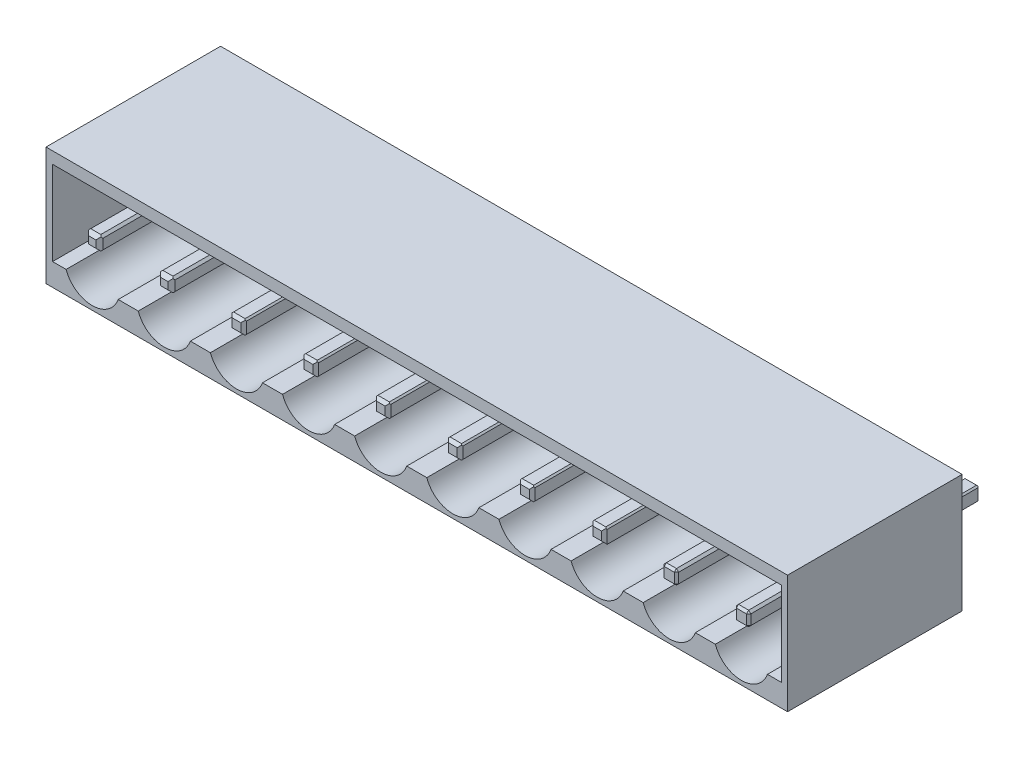
from build123d import *

# Parameters (mm, degrees)
SKETCH_1_W          = 51.4
SKETCH_1_H          = 8.2
EXTRUDE_1_DEPTH     = 12.1
SKETCH_4_R          = 1.25
CUT_EXTRUDE_3_DEPTH = 8
CUT_EXTRUDE_4_DEPTH = 7.8
SKETCH_7_W          = 1
SKETCH_7_H          = 1
EXTRUDE_2_DEPTH     = 8
CHAMFER_1_SIZE      = 0.15
CHAMFER_2_SIZE      = 0.25
SKETCH_8_W          = 1
SKETCH_8_H          = 1
EXTRUDE_3_DEPTH     = 4
CHAMFER_6_SIZE      = 0.1
CHAMFER_7_SIZE      = 0.2
CHAMFER_10_SIZE     = 0.1
CHAMFER_11_SIZE     = 0.2
CHAMFER_12_SIZE     = 0.1
CHAMFER_13_SIZE     = 0.2
CHAMFER_14_SIZE     = 0.1
CHAMFER_15_SIZE     = 0.2


with BuildPart() as part:
    # Эскиз1 → Бобышка-Вытянуть1 (new body)
    with BuildSketch(Plane.XY):
        Rectangle(SKETCH_1_W, SKETCH_1_H)
    extrude(amount=EXTRUDE_1_DEPTH)

    # Эскиз4 → Вырез-Вытянуть3 (cut)
    with BuildSketch(Plane.XY.offset(12.1)):
        with Locations((-22.5, 0)):
            Circle(SKETCH_4_R)
        with Locations((-17.5, 0)):
            Circle(SKETCH_4_R)
        with Locations((-12.5, 0)):
            Circle(SKETCH_4_R)
        with Locations((-7.5, 0)):
            Circle(SKETCH_4_R)
        with Locations((-2.5, 0)):
            Circle(SKETCH_4_R)
        with Locations((2.5, 0)):
            Circle(SKETCH_4_R)
        with Locations((7.5, 0)):
            Circle(SKETCH_4_R)
        with Locations((12.5, 0)):
            Circle(SKETCH_4_R)
        with Locations((17.5, 0)):
            Circle(SKETCH_4_R)
        with Locations((22.5, 0)):
            Circle(SKETCH_4_R)
    extrude(amount=-CUT_EXTRUDE_3_DEPTH, mode=Mode.SUBTRACT)

    # Эскиз5 → Вырез-Вытянуть4 (cut)
    with BuildSketch(Plane.XY.offset(12.1)):
        with BuildLine():
            Line((-25.245621634, 0), (-25.245621634, 3.292901982))
            Line((-25.245621634, 3.292901982), (-14.721490456, 3.292901982))
            Line((-14.721490456, 3.292901982), (-9.721490456, 3.292901982))
            Line((-9.721490456, 3.292901982), (-4.721490456, 3.292901982))
            Line((-4.721490456, 3.292901982), (5.278509544, 3.292901982))
            Line((5.278509544, 3.292901982), (15.278509544, 3.292901982))
            Line((15.278509544, 3.292901982), (25.278509544, 3.292901982))
            Line((25.278509544, 3.292901982), (25.278509544, -2.548957219))
            Line((25.278509544, -2.548957219), (24.30582632, -2.548957219))
            ThreePointArc((24.30582632, -2.548957219), (22.5, -3.818893996), (20.69417368, -2.548957219))
            Line((20.69417368, -2.548957219), (19.30582632, -2.548957219))
            ThreePointArc((19.30582632, -2.548957219), (17.5, -3.818893996), (15.69417368, -2.548957219))
            Line((15.69417368, -2.548957219), (14.30582632, -2.548957219))
            ThreePointArc((14.30582632, -2.548957219), (12.5, -3.818893996), (10.69417368, -2.548957219))
            Line((10.69417368, -2.548957219), (9.30582632, -2.548957219))
            ThreePointArc((9.30582632, -2.548957219), (7.5, -3.818893996), (5.69417368, -2.548957219))
            Line((5.69417368, -2.548957219), (4.30582632, -2.548957219))
            ThreePointArc((4.30582632, -2.548957219), (2.5, -3.818893996), (0.69417368, -2.548957219))
            Line((0.69417368, -2.548957219), (-0.69417368, -2.548957219))
            ThreePointArc((-0.69417368, -2.548957219), (-2.5, -3.818893996), (-4.30582632, -2.548957219))
            Line((-4.30582632, -2.548957219), (-5.69417368, -2.548957219))
            ThreePointArc((-5.69417368, -2.548957219), (-7.5, -3.818893996), (-9.30582632, -2.548957219))
            Line((-9.30582632, -2.548957219), (-10.69417368, -2.548957219))
            ThreePointArc((-10.69417368, -2.548957219), (-12.5, -3.818893996), (-14.30582632, -2.548957219))
            Line((-14.30582632, -2.548957219), (-15.69417368, -2.548957219))
            ThreePointArc((-15.69417368, -2.548957219), (-17.5, -3.818893996), (-19.30582632, -2.548957219))
            Line((-19.30582632, -2.548957219), (-20.69417368, -2.548957219))
            ThreePointArc((-20.69417368, -2.548957219), (-22.5, -3.818893996), (-24.30582632, -2.548957219))
            Line((-24.30582632, -2.548957219), (-25.245621634, -2.548957219))
            Line((-25.245621634, -2.548957219), (-25.245621634, 0))
        make_face()
    extrude(amount=-CUT_EXTRUDE_4_DEPTH, mode=Mode.SUBTRACT)

    # Эскиз7 → Бобышка-Вытянуть2 (add)
    with BuildSketch(Plane.XY.offset(4.1)):
        with Locations((-17.5, 0)):
            Rectangle(SKETCH_7_W, SKETCH_7_H)
        with Locations((-22.5, 0)):
            Rectangle(SKETCH_7_W, SKETCH_7_H)
        with Locations((-12.5, 0)):
            Rectangle(SKETCH_7_W, SKETCH_7_H)
        with Locations((-7.5, 0)):
            Rectangle(SKETCH_7_W, SKETCH_7_H)
        with Locations((-2.5, 0)):
            Rectangle(SKETCH_7_W, SKETCH_7_H)
        with Locations((2.5, 0)):
            Rectangle(SKETCH_7_W, SKETCH_7_H)
        with Locations((7.5, 0)):
            Rectangle(SKETCH_7_W, SKETCH_7_H)
        with Locations((12.5, 0)):
            Rectangle(SKETCH_7_W, SKETCH_7_H)
        with Locations((17.5, 0)):
            Rectangle(SKETCH_7_W, SKETCH_7_H)
        with Locations((22.5, 0)):
            Rectangle(SKETCH_7_W, SKETCH_7_H)
    extrude(amount=EXTRUDE_2_DEPTH)

    # Фаска1
    chamfer_1_edges = [part.edges().sort_by_distance(p)[0] for p in [
        (-18, -0.5, 8.1),
        (-18, 0.5, 8.1),
        (-17, 0.5, 8.1),
        (-17, -0.5, 8.1),
        (-22, -0.5, 8.1),
        (-22, 0.5, 8.1),
        (-23, -0.5, 8.1),
        (-23, 0.5, 8.1),
        (23, 0, 12.1),
        (23, -0.5, 8.1),
        (22.5, -0.5, 12.1),
        (22, -0.5, 8.1),
        (22, 0, 12.1),
        (22, 0.5, 8.1),
        (22.5, 0.5, 12.1),
        (23, 0.5, 8.1),
        (18, 0, 12.1),
        (18, -0.5, 8.1),
        (17.5, -0.5, 12.1),
        (17, -0.5, 8.1),
        (17, 0, 12.1),
        (17, 0.5, 8.1),
        (17.5, 0.5, 12.1),
        (18, 0.5, 8.1),
    ]]
    chamfer(chamfer_1_edges, length=CHAMFER_1_SIZE)

    # Фаска2
    # the kernel refuses this chamfer: 0.25 mm, written as the material it takes off along each edge
    with BuildSketch(Plane(origin=(-18, -0.992920747, 12.1), x_dir=(-0.027495876610582105, 0, -0.999621916911297), z_dir=(0, 1, 0)), Plane(origin=(-18.492920747, 0.5, 12.1), x_dir=(0, 0.027495876610586414, -0.9996219169112968), z_dir=(1, 0, 0)), Plane(origin=(-17, 0.992920747, 12.1), x_dir=(0.027495876610582105, 0, -0.999621916911297), z_dir=(0, -1, 0)), Plane(origin=(-16.507079253, -0.5, 12.1), x_dir=(0, -0.027495876610586414, -0.9996219169112968), z_dir=(-1, 0, 0)), Plane(origin=(-22, 0.992920747, 12.1), x_dir=(0.027495876610582105, 0, -0.999621916911297), z_dir=(0, -1, 0)), Plane(origin=(-21.507079253, -0.5, 12.1), x_dir=(0, -0.027495876610586414, -0.9996219169112968), z_dir=(-1, 0, 0)), Plane(origin=(-23, -0.992920747, 12.1), x_dir=(-0.027495876610582105, 0, -0.999621916911297), z_dir=(0, 1, 0)), Plane(origin=(-23.492920747, 0.5, 12.1), x_dir=(0, 0.027495876610586414, -0.9996219169112968), z_dir=(1, 0, 0))) as chamfer_2_piece_1:
        Polygon((CHAMFER_2_SIZE * 0.999621916911, -CHAMFER_2_SIZE * 0.0274958766106), (-CHAMFER_2_SIZE * 0.0274958766106, -CHAMFER_2_SIZE * 0.999621916911), (0, 0), align=None)
    extrude(amount=1.985841494, mode=Mode.SUBTRACT)

    # Эскиз8 → Бобышка-Вытянуть3 (add)
    with BuildSketch(Plane(origin=(0, -4.1, 0), x_dir=(-1, 0, 0), z_dir=(0, 0, 1))):
        with Locations((17.5, -3.75)):
            Rectangle(SKETCH_8_W, SKETCH_8_H)
        with Locations((22.5, -3.75)):
            Rectangle(SKETCH_8_W, SKETCH_8_H)
        with Locations((12.5, -3.75)):
            Rectangle(SKETCH_8_W, SKETCH_8_H)
        with Locations((7.5, -3.75)):
            Rectangle(SKETCH_8_W, SKETCH_8_H)
        with Locations((2.5, -3.75)):
            Rectangle(SKETCH_8_W, SKETCH_8_H)
        with Locations((-2.5, -3.75)):
            Rectangle(SKETCH_8_W, SKETCH_8_H)
        with Locations((-7.5, -3.75)):
            Rectangle(SKETCH_8_W, SKETCH_8_H)
        with Locations((-12.5, -3.75)):
            Rectangle(SKETCH_8_W, SKETCH_8_H)
        with Locations((-17.5, -3.75)):
            Rectangle(SKETCH_8_W, SKETCH_8_H)
        with Locations((-22.5, -3.75)):
            Rectangle(SKETCH_8_W, SKETCH_8_H)
    extrude(amount=-EXTRUDE_3_DEPTH)

    # Фаска6
    chamfer_6_edges = [part.edges().sort_by_distance(p)[0] for p in [
        (-12, -0.5, 8.1),
        (-12, 0.5, 8.1),
        (-13, 0.5, 8.1),
        (-13, -0.5, 8.1),
    ]]
    chamfer(chamfer_6_edges, length=CHAMFER_6_SIZE)

    # Фаска7
    # the kernel refuses this chamfer: 0.2 mm, written as the material it takes off along each edge
    with BuildSketch(Plane(origin=(-12, 0.914336598, 12.1), x_dir=(0.02749587661058742, 0, -0.9996219169112966), z_dir=(0, -1, 0)), Plane(origin=(-11.585663402, -0.5, 12.1), x_dir=(0, -0.02749587661058634, -0.9996219169112966), z_dir=(-1, 0, 0)), Plane(origin=(-13, -0.914336598, 12.1), x_dir=(-0.02749587661058742, 0, -0.9996219169112966), z_dir=(0, 1, 0)), Plane(origin=(-13.414336598, 0.5, 12.1), x_dir=(0, 0.02749587661058634, -0.9996219169112966), z_dir=(1, 0, 0))) as chamfer_7_piece_1:
        Polygon((CHAMFER_7_SIZE * 0.999621916911, -CHAMFER_7_SIZE * 0.0274958766106), (-CHAMFER_7_SIZE * 0.0274958766106, -CHAMFER_7_SIZE * 0.999621916911), (0, 0), align=None)
    extrude(amount=1.828673195, mode=Mode.SUBTRACT)

    # Фаска10
    chamfer_10_edges = [part.edges().sort_by_distance(p)[0] for p in [
        (-22, 0.15, -2),
        (-22, -0.85, -2),
        (-23, -0.85, -2),
        (-23, 0.15, -2),
        (-17, 0.15, -2),
        (-17, -0.85, -2),
        (-18, -0.85, -2),
        (-18, 0.15, -2),
        (-12, 0.15, -2),
        (-12, -0.85, -2),
        (-13, -0.85, -2),
        (-13, 0.15, -2),
    ]]
    chamfer(chamfer_10_edges, length=CHAMFER_10_SIZE)

    # Фаска11
    # the kernel refuses this chamfer: 0.2 mm, written as the material it takes off along each edge
    with BuildSketch(Plane(origin=(-22, 0.564336598, -4), x_dir=(0.027495876610578673, 0, 0.999621916911297), z_dir=(0, -1, 0)), Plane(origin=(-23.414336598, 0.15, -4), x_dir=(0, 0.027495876610586355, 0.9996219169112966), z_dir=(1, 0, 0)), Plane(origin=(-23, -1.264336598, -4), x_dir=(-0.027495876610578673, 0, 0.999621916911297), z_dir=(0, 1, 0)), Plane(origin=(-21.585663402, -0.85, -4), x_dir=(0, -0.027495876610586223, 0.9996219169112966), z_dir=(-1, 0, 0)), Plane(origin=(-16.585663402, -0.85, -4), x_dir=(0, -0.027495876610586223, 0.9996219169112966), z_dir=(-1, 0, 0)), Plane(origin=(-18, -1.264336598, -4), x_dir=(-0.027495876610578673, 0, 0.999621916911297), z_dir=(0, 1, 0)), Plane(origin=(-18.414336598, 0.15, -4), x_dir=(0, 0.027495876610586355, 0.9996219169112966), z_dir=(1, 0, 0)), Plane(origin=(-17, 0.564336598, -4), x_dir=(0.027495876610578673, 0, 0.999621916911297), z_dir=(0, -1, 0)), Plane(origin=(-13, -1.264336598, -4), x_dir=(-0.027495876610587302, 0, 0.9996219169112966), z_dir=(0, 1, 0)), Plane(origin=(-13.414336598, 0.15, -4), x_dir=(0, 0.027495876610586355, 0.9996219169112966), z_dir=(1, 0, 0)), Plane(origin=(-12, 0.564336598, -4), x_dir=(0.027495876610587302, 0, 0.9996219169112966), z_dir=(0, -1, 0)), Plane(origin=(-11.585663402, -0.85, -4), x_dir=(0, -0.027495876610586223, 0.9996219169112966), z_dir=(-1, 0, 0))) as chamfer_11_piece_1:
        Polygon((CHAMFER_11_SIZE * 0.999621916911, CHAMFER_11_SIZE * 0.0274958766106), (-CHAMFER_11_SIZE * 0.0274958766106, CHAMFER_11_SIZE * 0.999621916911), (0, 0), align=None)
    extrude(amount=1.828673195, mode=Mode.SUBTRACT)

    # Фаска12
    chamfer_12_edges = [part.edges().sort_by_distance(p)[0] for p in [
        (-2, -0.5, 8.1),
        (-2, 0.5, 8.1),
        (-3, 0.5, 8.1),
        (-3, -0.5, 8.1),
        (3, -0.5, 8.1),
        (3, 0.5, 8.1),
        (2, 0.5, 8.1),
        (2, -0.5, 8.1),
        (-7, 0.15, -2),
        (-7, -0.85, -2),
        (-8, -0.85, -2),
        (-8, 0.15, -2),
        (-2, 0.15, -2),
        (-2, -0.85, -2),
        (-3, -0.85, -2),
        (-3, 0.15, -2),
        (3, 0.15, -2),
        (3, -0.85, -2),
        (2, -0.85, -2),
        (2, 0.15, -2),
    ]]
    chamfer(chamfer_12_edges, length=CHAMFER_12_SIZE)

    # Фаска13
    # the kernel refuses this chamfer: 0.2 mm, written as the material it takes off along each edge
    with BuildSketch(Plane(origin=(-8.414336598, 0.15, -4), x_dir=(0, 0.027495876610586355, 0.9996219169112966), z_dir=(1, 0, 0)), Plane(origin=(-7, 0.564336598, -4), x_dir=(0.027495876610587302, 0, 0.9996219169112966), z_dir=(0, -1, 0)), Plane(origin=(-8, -1.264336598, -4), x_dir=(-0.027495876610587302, 0, 0.9996219169112966), z_dir=(0, 1, 0)), Plane(origin=(-6.585663402, -0.85, -4), x_dir=(0, -0.027495876610586223, 0.9996219169112966), z_dir=(-1, 0, 0))) as chamfer_13_piece_1:
        Polygon((CHAMFER_13_SIZE * 0.999621916911, CHAMFER_13_SIZE * 0.0274958766106), (-CHAMFER_13_SIZE * 0.0274958766106, CHAMFER_13_SIZE * 0.999621916911), (0, 0), align=None)
    extrude(amount=1.828673195, mode=Mode.SUBTRACT)

    # Фаска14
    chamfer_14_edges = [part.edges().sort_by_distance(p)[0] for p in [
        (-7, -0.5, 8.1),
        (-7, 0.5, 8.1),
        (-8, 0.5, 8.1),
        (-8, -0.5, 8.1),
        (8, -0.5, 8.1),
        (8, 0.5, 8.1),
        (7, 0.5, 8.1),
        (7, -0.5, 8.1),
        (13, 0.5, 8.1),
        (12, 0.5, 8.1),
        (8, 0.15, -2),
        (8, -0.85, -2),
        (7, -0.85, -2),
        (7, 0.15, -2),
        (13, 0.15, -2),
        (13, -0.85, -2),
        (12, -0.85, -2),
        (12, 0.15, -2),
        (18, 0.15, -2),
        (18, -0.85, -2),
        (17, -0.85, -2),
        (17, 0.15, -2),
        (23, 0.15, -2),
        (23, -0.85, -2),
        (22, -0.85, -2),
        (22, 0.15, -2),
    ]]
    chamfer(chamfer_14_edges, length=CHAMFER_14_SIZE)

    # Фаска15
    # the kernel refuses this chamfer: 0.2 mm, written as the material it takes off along each edge
    with BuildSketch(Plane(origin=(-8, -0.914336598, 12.1), x_dir=(-0.02749587661058742, 0, -0.9996219169112966), z_dir=(0, 1, 0)), Plane(origin=(-6.585663402, -0.5, 12.1), x_dir=(0, -0.02749587661058634, -0.9996219169112966), z_dir=(-1, 0, 0)), Plane(origin=(-7, 0.914336598, 12.1), x_dir=(0.02749587661058742, 0, -0.9996219169112966), z_dir=(0, -1, 0)), Plane(origin=(-8.414336598, 0.5, 12.1), x_dir=(0, 0.02749587661058634, -0.9996219169112966), z_dir=(1, 0, 0)), Plane(origin=(3, 0.914336598, 12.1), x_dir=(0.02749587661058742, 0, -0.9996219169112966), z_dir=(0, -1, 0)), Plane(origin=(3.414336598, -0.5, 12.1), x_dir=(0, -0.02749587661058634, -0.9996219169112966), z_dir=(-1, 0, 0)), Plane(origin=(2, -0.914336598, 12.1), x_dir=(-0.02749587661058634, 0, -0.9996219169112966), z_dir=(0, 1, 0)), Plane(origin=(1.585663402, 0.5, 12.1), x_dir=(0, 0.02749587661058634, -0.9996219169112966), z_dir=(1, 0, 0)), Plane(origin=(-1.585663402, -0.5, 12.1), x_dir=(0, -0.02749587661058634, -0.9996219169112966), z_dir=(-1, 0, 0)), Plane(origin=(-2, 0.914336598, 12.1), x_dir=(0.02749587661058634, 0, -0.9996219169112966), z_dir=(0, -1, 0)), Plane(origin=(-3, -0.914336598, 12.1), x_dir=(-0.02749587661058742, 0, -0.9996219169112966), z_dir=(0, 1, 0)), Plane(origin=(-3.414336598, 0.5, 12.1), x_dir=(0, 0.02749587661058634, -0.9996219169112966), z_dir=(1, 0, 0)), Plane(origin=(11.585663402, 0.5, 12.1), x_dir=(0, 0.02749587661058634, -0.9996219169112966), z_dir=(1, 0, 0)), Plane(origin=(7, -0.914336598, 12.1), x_dir=(-0.02749587661058742, 0, -0.9996219169112966), z_dir=(0, 1, 0)), Plane(origin=(8.414336598, -0.5, 12.1), x_dir=(0, -0.02749587661058634, -0.9996219169112966), z_dir=(-1, 0, 0)), Plane(origin=(8, 0.914336598, 12.1), x_dir=(0.02749587661058742, 0, -0.9996219169112966), z_dir=(0, -1, 0)), Plane(origin=(6.585663402, 0.5, 12.1), x_dir=(0, 0.02749587661058634, -0.9996219169112966), z_dir=(1, 0, 0))) as chamfer_15_piece_1:
        Polygon((CHAMFER_15_SIZE * 0.999621916911, -CHAMFER_15_SIZE * 0.0274958766106), (-CHAMFER_15_SIZE * 0.0274958766106, -CHAMFER_15_SIZE * 0.999621916911), (0, 0), align=None)
    extrude(amount=1.828673195, mode=Mode.SUBTRACT)
    with BuildSketch(Plane(origin=(-3, -1.264336598, -4), x_dir=(-0.027495876610587302, 0, 0.9996219169112966), z_dir=(0, 1, 0)), Plane(origin=(-1.585663402, -0.85, -4), x_dir=(0, -0.027495876610586223, 0.9996219169112966), z_dir=(-1, 0, 0)), Plane(origin=(-2, 0.564336598, -4), x_dir=(0.027495876610586223, 0, 0.9996219169112966), z_dir=(0, -1, 0)), Plane(origin=(-3.414336598, 0.15, -4), x_dir=(0, 0.027495876610586355, 0.9996219169112966), z_dir=(1, 0, 0)), Plane(origin=(2, -1.264336598, -4), x_dir=(-0.027495876610586223, 0, 0.9996219169112966), z_dir=(0, 1, 0)), Plane(origin=(3.414336598, -0.85, -4), x_dir=(0, -0.027495876610586223, 0.9996219169112966), z_dir=(-1, 0, 0)), Plane(origin=(3, 0.564336598, -4), x_dir=(0.027495876610587302, 0, 0.9996219169112966), z_dir=(0, -1, 0)), Plane(origin=(1.585663402, 0.15, -4), x_dir=(0, 0.027495876610586355, 0.9996219169112966), z_dir=(1, 0, 0)), Plane(origin=(13.414336598, -0.85, -4), x_dir=(0, -0.027495876610586223, 0.9996219169112966), z_dir=(-1, 0, 0)), Plane(origin=(13, 0.564336598, -4), x_dir=(0.027495876610587302, 0, 0.9996219169112966), z_dir=(0, -1, 0)), Plane(origin=(12, -1.264336598, -4), x_dir=(-0.027495876610587302, 0, 0.9996219169112966), z_dir=(0, 1, 0)), Plane(origin=(11.585663402, 0.15, -4), x_dir=(0, 0.027495876610586355, 0.9996219169112966), z_dir=(1, 0, 0)), Plane(origin=(8, 0.564336598, -4), x_dir=(0.027495876610587302, 0, 0.9996219169112966), z_dir=(0, -1, 0)), Plane(origin=(8.414336598, -0.85, -4), x_dir=(0, -0.027495876610586223, 0.9996219169112966), z_dir=(-1, 0, 0)), Plane(origin=(7, -1.264336598, -4), x_dir=(-0.027495876610587302, 0, 0.9996219169112966), z_dir=(0, 1, 0)), Plane(origin=(6.585663402, 0.15, -4), x_dir=(0, 0.027495876610586355, 0.9996219169112966), z_dir=(1, 0, 0)), Plane(origin=(21.585663402, 0.15, -4), x_dir=(0, 0.027495876610586355, 0.9996219169112966), z_dir=(1, 0, 0)), Plane(origin=(23, 0.564336598, -4), x_dir=(0.027495876610578673, 0, 0.999621916911297), z_dir=(0, -1, 0)), Plane(origin=(23.414336598, -0.85, -4), x_dir=(0, -0.027495876610586223, 0.9996219169112966), z_dir=(-1, 0, 0)), Plane(origin=(22, -1.264336598, -4), x_dir=(-0.027495876610578673, 0, 0.999621916911297), z_dir=(0, 1, 0)), Plane(origin=(17, -1.264336598, -4), x_dir=(-0.027495876610578673, 0, 0.999621916911297), z_dir=(0, 1, 0)), Plane(origin=(18.414336598, -0.85, -4), x_dir=(0, -0.027495876610586223, 0.9996219169112966), z_dir=(-1, 0, 0)), Plane(origin=(18, 0.564336598, -4), x_dir=(0.027495876610578673, 0, 0.999621916911297), z_dir=(0, -1, 0)), Plane(origin=(16.585663402, 0.15, -4), x_dir=(0, 0.027495876610586355, 0.9996219169112966), z_dir=(1, 0, 0))) as chamfer_15_piece_2:
        Polygon((CHAMFER_15_SIZE * 0.999621916911, CHAMFER_15_SIZE * 0.0274958766106), (-CHAMFER_15_SIZE * 0.0274958766106, CHAMFER_15_SIZE * 0.999621916911), (0, 0), align=None)
    extrude(amount=1.828673195, mode=Mode.SUBTRACT)
    with BuildSketch(Plane(origin=(13, 0.914336598, 12.1), x_dir=(0.02749587661058742, 0, -0.9996219169112966), z_dir=(0, -1, 0)), Plane(origin=(12, -1.014336598, 12.1), x_dir=(-0.02749587661058742, 0, -0.9996219169112966), z_dir=(0, 1, 0))) as chamfer_15_piece_3:
        Polygon((CHAMFER_15_SIZE * 0.999621916911, -CHAMFER_15_SIZE * 0.0274958766106), (-CHAMFER_15_SIZE * 0.0274958766106, -CHAMFER_15_SIZE * 0.999621916911), (0, 0), align=None)
    extrude(amount=1.928673195, mode=Mode.SUBTRACT)
    with BuildSketch(Plane(origin=(13.514336598, -0.5, 12.1), x_dir=(0, -0.02749587661058634, -0.9996219169112966), z_dir=(-1, 0, 0))) as chamfer_15_piece_4:
        Polygon((CHAMFER_15_SIZE * 0.999621916911, -CHAMFER_15_SIZE * 0.0274958766106), (-CHAMFER_15_SIZE * 0.0274958766106, -CHAMFER_15_SIZE * 0.999621916911), (0, 0), align=None)
    extrude(amount=2.028673195, mode=Mode.SUBTRACT)


solid = part.part
